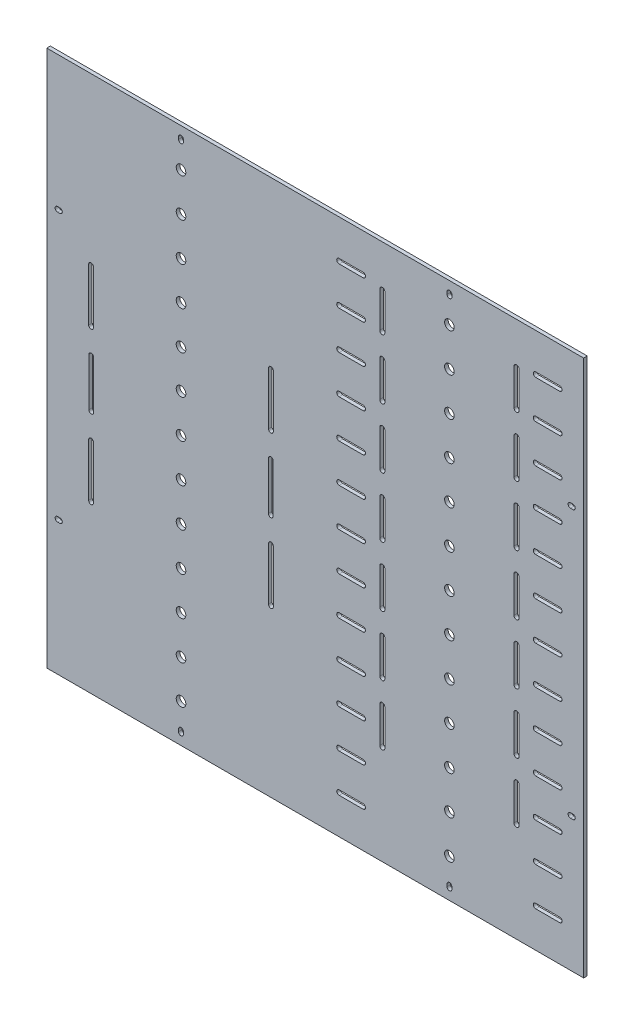
from build123d import *

# Parameters (mm, degrees)
SCHIZZO1_W                   = 448
SCHIZZO1_H                   = 448
SCHIZZO1_R                   = 4
ESTRUSIONE_ESTRUSIONE1_DEPTH = 3


with BuildPart() as part:
    # Schizzo1 → Estrusione-Estrusione1 (new body)
    with BuildSketch(Plane.XY):
        with Locations((224, 224)):
            Rectangle(SCHIZZO1_W, SCHIZZO1_H)
        with Locations((335.970716632, 416)):
            Circle(SCHIZZO1_R, mode=Mode.SUBTRACT)
        with Locations((335.970716632, 384)):
            Circle(SCHIZZO1_R, mode=Mode.SUBTRACT)
        with Locations((335.970716632, 352)):
            Circle(SCHIZZO1_R, mode=Mode.SUBTRACT)
        with Locations((335.970716632, 320)):
            Circle(SCHIZZO1_R, mode=Mode.SUBTRACT)
        with Locations((335.970716632, 288)):
            Circle(SCHIZZO1_R, mode=Mode.SUBTRACT)
        with Locations((335.970716632, 256)):
            Circle(SCHIZZO1_R, mode=Mode.SUBTRACT)
        with Locations((335.970716632, 224)):
            Circle(SCHIZZO1_R, mode=Mode.SUBTRACT)
        with Locations((335.970716632, 192)):
            Circle(SCHIZZO1_R, mode=Mode.SUBTRACT)
        with Locations((335.970716632, 160)):
            Circle(SCHIZZO1_R, mode=Mode.SUBTRACT)
        with Locations((335.970716632, 128)):
            Circle(SCHIZZO1_R, mode=Mode.SUBTRACT)
        with Locations((335.970716632, 96)):
            Circle(SCHIZZO1_R, mode=Mode.SUBTRACT)
        with Locations((335.970716632, 64)):
            Circle(SCHIZZO1_R, mode=Mode.SUBTRACT)
        with Locations((335.970716632, 32)):
            Circle(SCHIZZO1_R, mode=Mode.SUBTRACT)
        with Locations((112.029283368, 32)):
            Circle(SCHIZZO1_R, mode=Mode.SUBTRACT)
        with Locations((112.029283368, 64)):
            Circle(SCHIZZO1_R, mode=Mode.SUBTRACT)
        with Locations((112.029283368, 96)):
            Circle(SCHIZZO1_R, mode=Mode.SUBTRACT)
        with Locations((112.029283368, 128)):
            Circle(SCHIZZO1_R, mode=Mode.SUBTRACT)
        with Locations((112.029283368, 160)):
            Circle(SCHIZZO1_R, mode=Mode.SUBTRACT)
        with Locations((112.029283368, 192)):
            Circle(SCHIZZO1_R, mode=Mode.SUBTRACT)
        with Locations((112.029283368, 224)):
            Circle(SCHIZZO1_R, mode=Mode.SUBTRACT)
        with Locations((112.029283368, 256)):
            Circle(SCHIZZO1_R, mode=Mode.SUBTRACT)
        with Locations((112.029283368, 288)):
            Circle(SCHIZZO1_R, mode=Mode.SUBTRACT)
        with Locations((112.029283368, 320)):
            Circle(SCHIZZO1_R, mode=Mode.SUBTRACT)
        with Locations((112.029283368, 352)):
            Circle(SCHIZZO1_R, mode=Mode.SUBTRACT)
        with Locations((112.029283368, 384)):
            Circle(SCHIZZO1_R, mode=Mode.SUBTRACT)
        with Locations((112.029283368, 416)):
            Circle(SCHIZZO1_R, mode=Mode.SUBTRACT)
        with BuildLine():
            Line((9, 338), (11, 338))
            ThreePointArc((11, 338), (13, 336), (11, 334))
            Line((11, 334), (9, 334))
            ThreePointArc((9, 334), (7, 336), (9, 338))
        make_face(mode=Mode.SUBTRACT)
        with BuildLine():
            Line((9, 110), (11, 110))
            ThreePointArc((11, 110), (13, 112), (11, 114))
            Line((11, 114), (9, 114))
            ThreePointArc((9, 114), (7, 112), (9, 110))
        make_face(mode=Mode.SUBTRACT)
        with BuildLine():
            Line((439, 110), (437, 110))
            ThreePointArc((437, 110), (435, 112), (437, 114))
            Line((437, 114), (439, 114))
            ThreePointArc((439, 114), (441, 112), (439, 110))
        make_face(mode=Mode.SUBTRACT)
        with BuildLine():
            Line((439, 338), (437, 338))
            ThreePointArc((437, 338), (435, 336), (437, 334))
            Line((437, 334), (439, 334))
            ThreePointArc((439, 334), (441, 336), (439, 338))
        make_face(mode=Mode.SUBTRACT)
        with BuildLine():
            Line((114, 439), (114, 437))
            ThreePointArc((114, 437), (112, 435), (110, 437))
            Line((110, 437), (110, 439))
            ThreePointArc((110, 439), (112, 441), (114, 439))
        make_face(mode=Mode.SUBTRACT)
        with BuildLine():
            Line((334, 439), (334, 437))
            ThreePointArc((334, 437), (336, 435), (338, 437))
            Line((338, 437), (338, 439))
            ThreePointArc((338, 439), (336, 441), (334, 439))
        make_face(mode=Mode.SUBTRACT)
        with BuildLine():
            Line((114, 9), (114, 11))
            ThreePointArc((114, 11), (112, 13), (110, 11))
            Line((110, 11), (110, 9))
            ThreePointArc((110, 9), (112, 7), (114, 9))
        make_face(mode=Mode.SUBTRACT)
        with BuildLine():
            Line((334, 9), (334, 11))
            ThreePointArc((334, 11), (336, 13), (338, 11))
            Line((338, 11), (338, 9))
            ThreePointArc((338, 9), (336, 7), (334, 9))
        make_face(mode=Mode.SUBTRACT)
        with BuildLine():
            Line((34.958788995, 265.366145204), (34.958788995, 309.366145204))
            ThreePointArc((34.958788995, 309.366145204), (36.958788995, 311.366145204), (38.958788995, 309.366145204))
            Line((38.958788995, 309.366145204), (38.958788995, 265.366145204))
            ThreePointArc((38.958788995, 265.366145204), (36.958788995, 263.366145204), (34.958788995, 265.366145204))
        make_face(mode=Mode.SUBTRACT)
        with BuildLine():
            Line((34.958788995, 182.633854796), (34.958788995, 138.633854796))
            ThreePointArc((34.958788995, 138.633854796), (36.958788995, 136.633854796), (38.958788995, 138.633854796))
            Line((38.958788995, 138.633854796), (38.958788995, 182.633854796))
            ThreePointArc((38.958788995, 182.633854796), (36.958788995, 184.633854796), (34.958788995, 182.633854796))
        make_face(mode=Mode.SUBTRACT)
        with BuildLine():
            Line((35.086959829, 204.138830615), (35.086959829, 244.138830615))
            ThreePointArc((35.086959829, 244.138830615), (37.086959829, 246.138830615), (39.086959829, 244.138830615))
            Line((39.086959829, 244.138830615), (39.086959829, 204.138830615))
            ThreePointArc((39.086959829, 204.138830615), (37.086959829, 202.138830615), (35.086959829, 204.138830615))
        make_face(mode=Mode.SUBTRACT)
        with BuildLine():
            Line((189.041211005, 265.366145204), (189.041211005, 309.366145204))
            ThreePointArc((189.041211005, 309.366145204), (187.041211005, 311.366145204), (185.041211005, 309.366145204))
            Line((185.041211005, 309.366145204), (185.041211005, 265.366145204))
            ThreePointArc((185.041211005, 265.366145204), (187.041211005, 263.366145204), (189.041211005, 265.366145204))
        make_face(mode=Mode.SUBTRACT)
        with BuildLine():
            Line((188.913040171, 204.138830615), (188.913040171, 244.138830615))
            ThreePointArc((188.913040171, 244.138830615), (186.913040171, 246.138830615), (184.913040171, 244.138830615))
            Line((184.913040171, 244.138830615), (184.913040171, 204.138830615))
            ThreePointArc((184.913040171, 204.138830615), (186.913040171, 202.138830615), (188.913040171, 204.138830615))
        make_face(mode=Mode.SUBTRACT)
        with BuildLine():
            Line((189.041211005, 182.633854796), (189.041211005, 138.633854796))
            ThreePointArc((189.041211005, 138.633854796), (187.041211005, 136.633854796), (185.041211005, 138.633854796))
            Line((185.041211005, 138.633854796), (185.041211005, 182.633854796))
            ThreePointArc((185.041211005, 182.633854796), (187.041211005, 184.633854796), (189.041211005, 182.633854796))
        make_face(mode=Mode.SUBTRACT)
        with BuildLine():
            Line((243.970716252, 418), (263.970716252, 418))
            ThreePointArc((263.970716252, 418), (265.970716252, 416), (263.970716252, 414))
            Line((263.970716252, 414), (243.970716252, 414))
            ThreePointArc((243.970716252, 414), (241.970716252, 416), (243.970716252, 418))
        make_face(mode=Mode.SUBTRACT)
        with BuildLine():
            Line((427.970329998, 418.017724106), (407.970330369, 418.013871032))
            ThreePointArc((407.970330369, 418.013871032), (405.970715714, 416.013485761), (407.971100984, 414.013871106))
            Line((407.971100984, 414.013871106), (427.971100613, 414.017724181))
            ThreePointArc((427.971100613, 414.017724181), (429.970715268, 416.018109451), (427.970329998, 418.017724106))
        make_face(mode=Mode.SUBTRACT)
        with BuildLine():
            Line((243.970716252, 386), (263.970716252, 386))
            ThreePointArc((263.970716252, 386), (265.970716252, 384), (263.970716252, 382))
            Line((263.970716252, 382), (243.970716252, 382))
            ThreePointArc((243.970716252, 382), (241.970716252, 384), (243.970716252, 386))
        make_face(mode=Mode.SUBTRACT)
        with BuildLine():
            Line((427.970329998, 386.017724106), (407.970330369, 386.013871032))
            ThreePointArc((407.970330369, 386.013871032), (405.970715714, 384.013485761), (407.971100984, 382.013871106))
            Line((407.971100984, 382.013871106), (427.971100613, 382.017724181))
            ThreePointArc((427.971100613, 382.017724181), (429.970715268, 384.018109451), (427.970329998, 386.017724106))
        make_face(mode=Mode.SUBTRACT)
        with BuildLine():
            Line((277.872450261, 383.004982615), (277.872450261, 412.995017385))
            ThreePointArc((277.872450261, 412.995017385), (279.972450256, 415.09501738), (282.072450251, 412.995017385))
            Line((282.072450251, 412.995017385), (282.072450251, 383.004982615))
            ThreePointArc((282.072450251, 383.004982615), (279.972450256, 380.90498262), (277.872450261, 383.004982615))
        make_face(mode=Mode.SUBTRACT)
        with BuildLine():
            Line((243.970716252, 354), (263.970716252, 354))
            ThreePointArc((263.970716252, 354), (265.970716252, 352), (263.970716252, 350))
            Line((263.970716252, 350), (243.970716252, 350))
            ThreePointArc((243.970716252, 350), (241.970716252, 352), (243.970716252, 354))
        make_face(mode=Mode.SUBTRACT)
        with BuildLine():
            Line((427.970329998, 354.017724106), (407.970330369, 354.013871032))
            ThreePointArc((407.970330369, 354.013871032), (405.970715714, 352.013485761), (407.971100984, 350.013871106))
            Line((407.971100984, 350.013871106), (427.971100613, 350.017724181))
            ThreePointArc((427.971100613, 350.017724181), (429.970715268, 352.018109451), (427.970329998, 354.017724106))
        make_face(mode=Mode.SUBTRACT)
        with BuildLine():
            Line((243.970716252, 322), (263.970716252, 322))
            ThreePointArc((263.970716252, 322), (265.970716252, 320), (263.970716252, 318))
            Line((263.970716252, 318), (243.970716252, 318))
            ThreePointArc((243.970716252, 318), (241.970716252, 320), (243.970716252, 322))
        make_face(mode=Mode.SUBTRACT)
        with BuildLine():
            Line((427.970329998, 322.017724106), (407.970330369, 322.013871032))
            ThreePointArc((407.970330369, 322.013871032), (405.970715714, 320.013485761), (407.971100984, 318.013871106))
            Line((407.971100984, 318.013871106), (427.971100613, 318.017724181))
            ThreePointArc((427.971100613, 318.017724181), (429.970715268, 320.018109451), (427.970329998, 322.017724106))
        make_face(mode=Mode.SUBTRACT)
        with BuildLine():
            Line((394.072449736, 383.005806193), (394.072449736, 413.015771025))
            ThreePointArc((394.072449736, 413.015771025), (391.972449736, 415.115771025), (389.872449736, 413.015771025))
            Line((389.872449736, 413.015771025), (389.872449736, 383.005806193))
            ThreePointArc((389.872449736, 383.005806193), (391.972449736, 380.905806193), (394.072449736, 383.005806193))
        make_face(mode=Mode.SUBTRACT)
        with BuildLine():
            Line((243.970716252, 290), (263.970716252, 290))
            ThreePointArc((263.970716252, 290), (265.970716252, 288), (263.970716252, 286))
            Line((263.970716252, 286), (243.970716252, 286))
            ThreePointArc((243.970716252, 286), (241.970716252, 288), (243.970716252, 290))
        make_face(mode=Mode.SUBTRACT)
        with BuildLine():
            Line((427.970329998, 290.017724106), (407.970330369, 290.013871032))
            ThreePointArc((407.970330369, 290.013871032), (405.970715714, 288.013485761), (407.971100984, 286.013871106))
            Line((407.971100984, 286.013871106), (427.971100613, 286.017724181))
            ThreePointArc((427.971100613, 286.017724181), (429.970715268, 288.018109451), (427.970329998, 290.017724106))
        make_face(mode=Mode.SUBTRACT)
        with BuildLine():
            Line((243.970716252, 258), (263.970716252, 258))
            ThreePointArc((263.970716252, 258), (265.970716252, 256), (263.970716252, 254))
            Line((263.970716252, 254), (243.970716252, 254))
            ThreePointArc((243.970716252, 254), (241.970716252, 256), (243.970716252, 258))
        make_face(mode=Mode.SUBTRACT)
        with BuildLine():
            Line((427.970329998, 258.017724106), (407.970330369, 258.013871032))
            ThreePointArc((407.970330369, 258.013871032), (405.970715714, 256.013485761), (407.971100984, 254.013871106))
            Line((407.971100984, 254.013871106), (427.971100613, 254.017724181))
            ThreePointArc((427.971100613, 254.017724181), (429.970715268, 256.018109451), (427.970329998, 258.017724106))
        make_face(mode=Mode.SUBTRACT)
        with BuildLine():
            Line((243.970716252, 226), (263.970716252, 226))
            ThreePointArc((263.970716252, 226), (265.970716252, 224), (263.970716252, 222))
            Line((263.970716252, 222), (243.970716252, 222))
            ThreePointArc((243.970716252, 222), (241.970716252, 224), (243.970716252, 226))
        make_face(mode=Mode.SUBTRACT)
        with BuildLine():
            Line((427.970329998, 226.017724106), (407.970330369, 226.013871032))
            ThreePointArc((407.970330369, 226.013871032), (405.970715714, 224.013485761), (407.971100984, 222.013871106))
            Line((407.971100984, 222.013871106), (427.971100613, 222.017724181))
            ThreePointArc((427.971100613, 222.017724181), (429.970715268, 224.018109451), (427.970329998, 226.017724106))
        make_face(mode=Mode.SUBTRACT)
        with BuildLine():
            Line((243.970716252, 194), (263.970716252, 194))
            ThreePointArc((263.970716252, 194), (265.970716252, 192), (263.970716252, 190))
            Line((263.970716252, 190), (243.970716252, 190))
            ThreePointArc((243.970716252, 190), (241.970716252, 192), (243.970716252, 194))
        make_face(mode=Mode.SUBTRACT)
        with BuildLine():
            Line((427.970329998, 194.017724106), (407.970330369, 194.013871032))
            ThreePointArc((407.970330369, 194.013871032), (405.970715714, 192.013485761), (407.971100984, 190.013871106))
            Line((407.971100984, 190.013871106), (427.971100613, 190.017724181))
            ThreePointArc((427.971100613, 190.017724181), (429.970715268, 192.018109451), (427.970329998, 194.017724106))
        make_face(mode=Mode.SUBTRACT)
        with BuildLine():
            Line((243.970716252, 162), (263.970716252, 162))
            ThreePointArc((263.970716252, 162), (265.970716252, 160), (263.970716252, 158))
            Line((263.970716252, 158), (243.970716252, 158))
            ThreePointArc((243.970716252, 158), (241.970716252, 160), (243.970716252, 162))
        make_face(mode=Mode.SUBTRACT)
        with BuildLine():
            Line((427.970329998, 162.017724106), (407.970330369, 162.013871032))
            ThreePointArc((407.970330369, 162.013871032), (405.970715714, 160.013485761), (407.971100984, 158.013871106))
            Line((407.971100984, 158.013871106), (427.971100613, 158.017724181))
            ThreePointArc((427.971100613, 158.017724181), (429.970715268, 160.018109451), (427.970329998, 162.017724106))
        make_face(mode=Mode.SUBTRACT)
        with BuildLine():
            Line((243.970716252, 130), (263.970716252, 130))
            ThreePointArc((263.970716252, 130), (265.970716252, 128), (263.970716252, 126))
            Line((263.970716252, 126), (243.970716252, 126))
            ThreePointArc((243.970716252, 126), (241.970716252, 128), (243.970716252, 130))
        make_face(mode=Mode.SUBTRACT)
        with BuildLine():
            Line((427.970329998, 130.017724106), (407.970330369, 130.013871032))
            ThreePointArc((407.970330369, 130.013871032), (405.970715714, 128.013485761), (407.971100984, 126.013871106))
            Line((407.971100984, 126.013871106), (427.971100613, 126.017724181))
            ThreePointArc((427.971100613, 126.017724181), (429.970715268, 128.018109451), (427.970329998, 130.017724106))
        make_face(mode=Mode.SUBTRACT)
        with BuildLine():
            Line((277.872450261, 333.004982615), (277.872450261, 362.995017385))
            ThreePointArc((277.872450261, 362.995017385), (279.972450256, 365.09501738), (282.072450251, 362.995017385))
            Line((282.072450251, 362.995017385), (282.072450251, 333.004982615))
            ThreePointArc((282.072450251, 333.004982615), (279.972450256, 330.90498262), (277.872450261, 333.004982615))
        make_face(mode=Mode.SUBTRACT)
        with BuildLine():
            Line((394.072449736, 333.005806193), (394.072449736, 363.015771025))
            ThreePointArc((394.072449736, 363.015771025), (391.972449736, 365.115771025), (389.872449736, 363.015771025))
            Line((389.872449736, 363.015771025), (389.872449736, 333.005806193))
            ThreePointArc((389.872449736, 333.005806193), (391.972449736, 330.905806193), (394.072449736, 333.005806193))
        make_face(mode=Mode.SUBTRACT)
        with BuildLine():
            Line((277.872450261, 283.004982615), (277.872450261, 312.995017385))
            ThreePointArc((277.872450261, 312.995017385), (279.972450256, 315.09501738), (282.072450251, 312.995017385))
            Line((282.072450251, 312.995017385), (282.072450251, 283.004982615))
            ThreePointArc((282.072450251, 283.004982615), (279.972450256, 280.90498262), (277.872450261, 283.004982615))
        make_face(mode=Mode.SUBTRACT)
        with BuildLine():
            Line((394.072449736, 283.005806193), (394.072449736, 313.015771025))
            ThreePointArc((394.072449736, 313.015771025), (391.972449736, 315.115771025), (389.872449736, 313.015771025))
            Line((389.872449736, 313.015771025), (389.872449736, 283.005806193))
            ThreePointArc((389.872449736, 283.005806193), (391.972449736, 280.905806193), (394.072449736, 283.005806193))
        make_face(mode=Mode.SUBTRACT)
        with BuildLine():
            Line((277.872450261, 233.004982615), (277.872450261, 262.995017385))
            ThreePointArc((277.872450261, 262.995017385), (279.972450256, 265.09501738), (282.072450251, 262.995017385))
            Line((282.072450251, 262.995017385), (282.072450251, 233.004982615))
            ThreePointArc((282.072450251, 233.004982615), (279.972450256, 230.90498262), (277.872450261, 233.004982615))
        make_face(mode=Mode.SUBTRACT)
        with BuildLine():
            Line((394.072449736, 233.005806193), (394.072449736, 263.015771025))
            ThreePointArc((394.072449736, 263.015771025), (391.972449736, 265.115771025), (389.872449736, 263.015771025))
            Line((389.872449736, 263.015771025), (389.872449736, 233.005806193))
            ThreePointArc((389.872449736, 233.005806193), (391.972449736, 230.905806193), (394.072449736, 233.005806193))
        make_face(mode=Mode.SUBTRACT)
        with BuildLine():
            Line((277.872450261, 183.004982615), (277.872450261, 212.995017385))
            ThreePointArc((277.872450261, 212.995017385), (279.972450256, 215.09501738), (282.072450251, 212.995017385))
            Line((282.072450251, 212.995017385), (282.072450251, 183.004982615))
            ThreePointArc((282.072450251, 183.004982615), (279.972450256, 180.90498262), (277.872450261, 183.004982615))
        make_face(mode=Mode.SUBTRACT)
        with BuildLine():
            Line((394.072449736, 183.005806193), (394.072449736, 213.015771025))
            ThreePointArc((394.072449736, 213.015771025), (391.972449736, 215.115771025), (389.872449736, 213.015771025))
            Line((389.872449736, 213.015771025), (389.872449736, 183.005806193))
            ThreePointArc((389.872449736, 183.005806193), (391.972449736, 180.905806193), (394.072449736, 183.005806193))
        make_face(mode=Mode.SUBTRACT)
        with BuildLine():
            Line((277.872450261, 133.004982615), (277.872450261, 162.995017385))
            ThreePointArc((277.872450261, 162.995017385), (279.972450256, 165.09501738), (282.072450251, 162.995017385))
            Line((282.072450251, 162.995017385), (282.072450251, 133.004982615))
            ThreePointArc((282.072450251, 133.004982615), (279.972450256, 130.90498262), (277.872450261, 133.004982615))
        make_face(mode=Mode.SUBTRACT)
        with BuildLine():
            Line((394.072449736, 133.005806193), (394.072449736, 163.015771025))
            ThreePointArc((394.072449736, 163.015771025), (391.972449736, 165.115771025), (389.872449736, 163.015771025))
            Line((389.872449736, 163.015771025), (389.872449736, 133.005806193))
            ThreePointArc((389.872449736, 133.005806193), (391.972449736, 130.905806193), (394.072449736, 133.005806193))
        make_face(mode=Mode.SUBTRACT)
        with BuildLine():
            Line((277.872450261, 83.004982615), (277.872450261, 112.995017385))
            ThreePointArc((277.872450261, 112.995017385), (279.972450256, 115.09501738), (282.072450251, 112.995017385))
            Line((282.072450251, 112.995017385), (282.072450251, 83.004982615))
            ThreePointArc((282.072450251, 83.004982615), (279.972450256, 80.90498262), (277.872450261, 83.004982615))
        make_face(mode=Mode.SUBTRACT)
        with BuildLine():
            Line((394.072449736, 83.005806193), (394.072449736, 113.015771025))
            ThreePointArc((394.072449736, 113.015771025), (391.972449736, 115.115771025), (389.872449736, 113.015771025))
            Line((389.872449736, 113.015771025), (389.872449736, 83.005806193))
            ThreePointArc((389.872449736, 83.005806193), (391.972449736, 80.905806193), (394.072449736, 83.005806193))
        make_face(mode=Mode.SUBTRACT)
        with BuildLine():
            Line((243.970716252, 98), (263.970716252, 98))
            ThreePointArc((263.970716252, 98), (265.970716252, 96), (263.970716252, 94))
            Line((263.970716252, 94), (243.970716252, 94))
            ThreePointArc((243.970716252, 94), (241.970716252, 96), (243.970716252, 98))
        make_face(mode=Mode.SUBTRACT)
        with BuildLine():
            Line((427.970329998, 98.017724106), (407.970330369, 98.013871032))
            ThreePointArc((407.970330369, 98.013871032), (405.970715714, 96.013485761), (407.971100984, 94.013871106))
            Line((407.971100984, 94.013871106), (427.971100613, 94.017724181))
            ThreePointArc((427.971100613, 94.017724181), (429.970715268, 96.018109451), (427.970329998, 98.017724106))
        make_face(mode=Mode.SUBTRACT)
        with BuildLine():
            Line((243.970716252, 66), (263.970716252, 66))
            ThreePointArc((263.970716252, 66), (265.970716252, 64), (263.970716252, 62))
            Line((263.970716252, 62), (243.970716252, 62))
            ThreePointArc((243.970716252, 62), (241.970716252, 64), (243.970716252, 66))
        make_face(mode=Mode.SUBTRACT)
        with BuildLine():
            Line((427.970329998, 66.017724106), (407.970330369, 66.013871032))
            ThreePointArc((407.970330369, 66.013871032), (405.970715714, 64.013485761), (407.971100984, 62.013871106))
            Line((407.971100984, 62.013871106), (427.971100613, 62.017724181))
            ThreePointArc((427.971100613, 62.017724181), (429.970715268, 64.018109451), (427.970329998, 66.017724106))
        make_face(mode=Mode.SUBTRACT)
        with BuildLine():
            Line((243.970716252, 34), (263.970716252, 34))
            ThreePointArc((263.970716252, 34), (265.970716252, 32), (263.970716252, 30))
            Line((263.970716252, 30), (243.970716252, 30))
            ThreePointArc((243.970716252, 30), (241.970716252, 32), (243.970716252, 34))
        make_face(mode=Mode.SUBTRACT)
        with BuildLine():
            Line((427.970329998, 34.017724106), (407.970330369, 34.013871032))
            ThreePointArc((407.970330369, 34.013871032), (405.970715714, 32.013485761), (407.971100984, 30.013871106))
            Line((407.971100984, 30.013871106), (427.971100613, 30.017724181))
            ThreePointArc((427.971100613, 30.017724181), (429.970715268, 32.018109451), (427.970329998, 34.017724106))
        make_face(mode=Mode.SUBTRACT)
    extrude(amount=-ESTRUSIONE_ESTRUSIONE1_DEPTH)


solid = part.part
